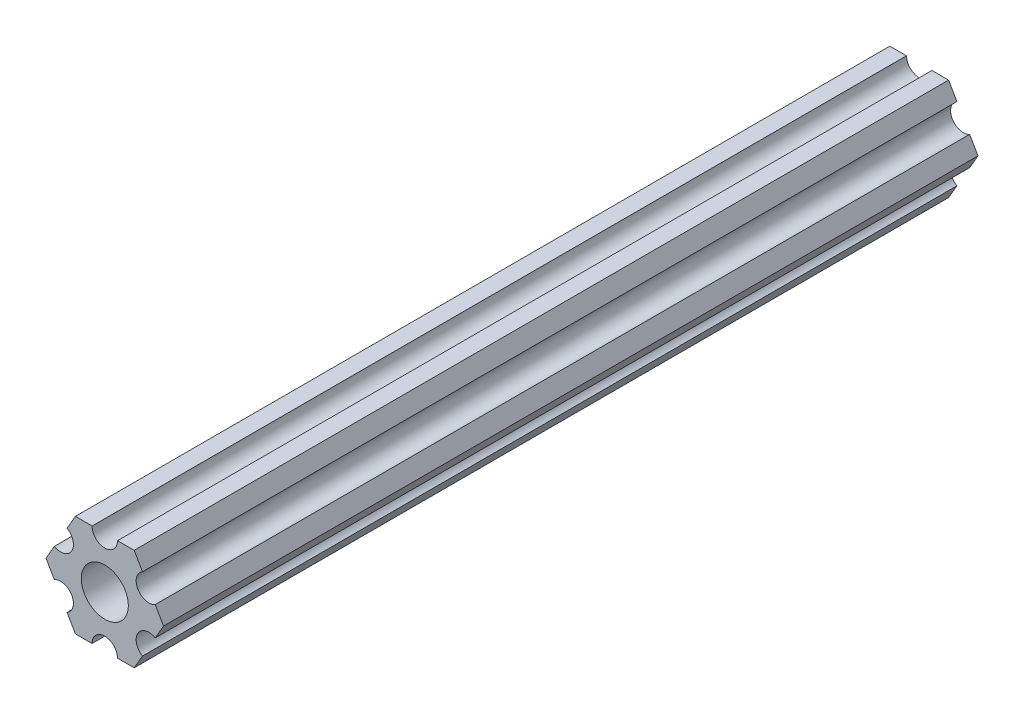
from build123d import *

# Parameters (mm, degrees)
SKETCH1_R           = 2.9337
BOSS_EXTRUDE1_DEPTH = 101.6


with BuildPart() as part:
    # Sketch1 → Boss-Extrude1 (new body)
    with BuildSketch(Plane.XY):
        with BuildLine():
            Line((-4.70551159, -4.549815043), (-3.666174521, -6.349999904))
            Line((-3.666174521, -6.349999904), (-1.587501154, -6.349999904))
            ThreePointArc((-1.587501154, -6.349999904), (-3.85e-07, -4.762499134), (1.587501154, -6.349999904))
            Line((1.587501154, -6.349999904), (3.666173825, -6.349999904))
            Line((3.666173825, -6.349999904), (4.705510929, -4.549815232))
            ThreePointArc((4.705510929, -4.549815232), (4.124445601, -2.381249904), (6.293010929, -1.800184575))
            Line((6.293010929, -1.800184575), (7.332348034, 9.6e-08))
            Line((7.332348034, 9.6e-08), (6.293011178, 1.800184715))
            ThreePointArc((6.293011178, 1.800184715), (4.124445902, 2.381250241), (4.705511428, 4.549815516))
            Line((4.705511428, 4.549815516), (3.666174521, 6.350000222))
            Line((3.666174521, 6.350000222), (1.587498846, 6.350000222))
            ThreePointArc((1.587498846, 6.350000222), (3.85e-07, 4.762501761), (-1.587498846, 6.350000222))
            Line((-1.587498846, 6.350000222), (-3.666173825, 6.350000222))
            Line((-3.666173825, 6.350000222), (-4.705511038, 4.549815614))
            ThreePointArc((-4.705511038, 4.549815614), (-4.124445841, 2.38125025), (-6.293011205, 1.800185053))
            Line((-6.293011205, 1.800185053), (-7.332348419, 4.44e-07))
            Line((-7.332348419, 4.44e-07), (-6.293011423, -1.80018429))
            ThreePointArc((-6.293011423, -1.80018429), (-4.12444613, -2.38124975), (-4.70551159, -4.549815043))
        make_face()
        Circle(SKETCH1_R, mode=Mode.SUBTRACT)
    extrude(amount=-BOSS_EXTRUDE1_DEPTH)


solid = part.part
